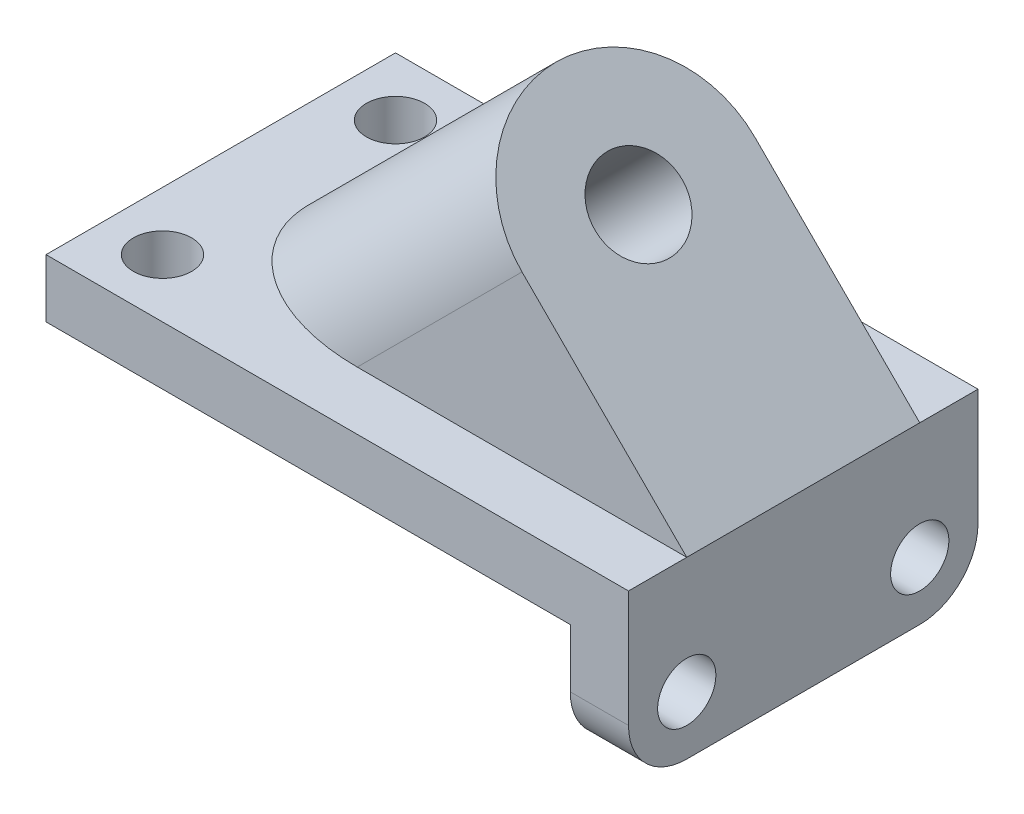
from build123d import *

# Parameters (mm, degrees)
SKETCH1_W           = 127
SKETCH1_H           = 76.2
SKETCH1_R           = 6.35
BOSS_EXTRUDE1_DEPTH = 12.7
SKETCH7_R           = 6.35
BOSS_EXTRUDE5_DEPTH = 12.7
BOSS_EXTRUDE9_REACH = 143.99
SKETCH13_R          = 9.525
CUT_EXTRUDE1_DEPTH  = 101.6


with BuildPart() as part:
    # Sketch1 → Boss-Extrude1 (new body)
    with BuildSketch(Plane(origin=(0, 0, 0), x_dir=(1, 0, 0), z_dir=(0, 1, 0))):
        with Locations((63.5, 38.1)):
            Rectangle(SKETCH1_W, SKETCH1_H)
        with Locations((12.7, 12.7)):
            Circle(SKETCH1_R, mode=Mode.SUBTRACT)
        with Locations((12.7, 63.5)):
            Circle(SKETCH1_R, mode=Mode.SUBTRACT)
    extrude(amount=-BOSS_EXTRUDE1_DEPTH)

    # Sketch7 → Boss-Extrude5 (add)
    with BuildSketch(Plane(origin=(127, 0, 0), x_dir=(0, 0, -1), z_dir=(1, 0, 0))):
        with BuildLine():
            Line((0, 0), (76.2, 0))
            Line((76.2, 0), (76.2, -25.4))
            ThreePointArc((76.2, -25.4), (72.480256121, -34.380256121), (63.5, -38.1))
            Line((63.5, -38.1), (12.7, -38.1))
            ThreePointArc((12.7, -38.1), (3.719743879, -34.380256121), (0, -25.4))
            Line((0, -25.4), (0, 0))
        make_face()
        with Locations((12.7, -25.4)):
            Circle(SKETCH7_R, mode=Mode.SUBTRACT)
        with Locations((63.5, -25.4)):
            Circle(SKETCH7_R, mode=Mode.SUBTRACT)
    extrude(amount=-BOSS_EXTRUDE5_DEPTH)

    # Boss-Extrude9: up to this face of the body (flat: up to its plane)
    boss_extrude9_end = Plane(part.part.faces().sort_by_distance((64.865694693, 0, -38.1))[0])
    # Sketch9 → Boss-Extrude9 (add, up to the picked face)
    with BuildSketch(Plane(origin=(63.5, 63.5, 0), x_dir=(0, 0, -1), z_dir=(0.7071067811865488, 0.7071067811865464, 0)), mode=Mode.PRIVATE) as boss_extrude9_sk1:
        with BuildLine():
            Line((12.7, -89.802561211), (63.5, -89.802561211))
            Line((63.5, -89.802561211), (63.5, -39.002561211))
            ThreePointArc((63.5, -39.002561211), (38.1, -13.602561211), (12.7, -39.002561211))
            Line((12.7, -39.002561211), (12.7, -89.802561211))
        make_face()
    boss_extrude9_tool1 = split(extrude(boss_extrude9_sk1.sketch, amount=-BOSS_EXTRUDE9_REACH, mode=Mode.PRIVATE), bisect_by=boss_extrude9_end, keep=Keep.BOTH, mode=Mode.PRIVATE)
    add(boss_extrude9_tool1.solids().sort_by(Axis((101.825801, 25.174199, -38.1), (-0.7071067811865488, -0.7071067811865464, 0)))[0])

    # Sketch13 → Cut-Extrude1 (cut)
    with BuildSketch(Plane(origin=(63.5, 63.5, 0), x_dir=(0, 0, -1), z_dir=(0.7071067811865487, 0.7071067811865465, 0))):
        with Locations((38.1, -39.002561211)):
            Circle(SKETCH13_R)
    extrude(amount=-CUT_EXTRUDE1_DEPTH, mode=Mode.SUBTRACT)


solid = part.part
